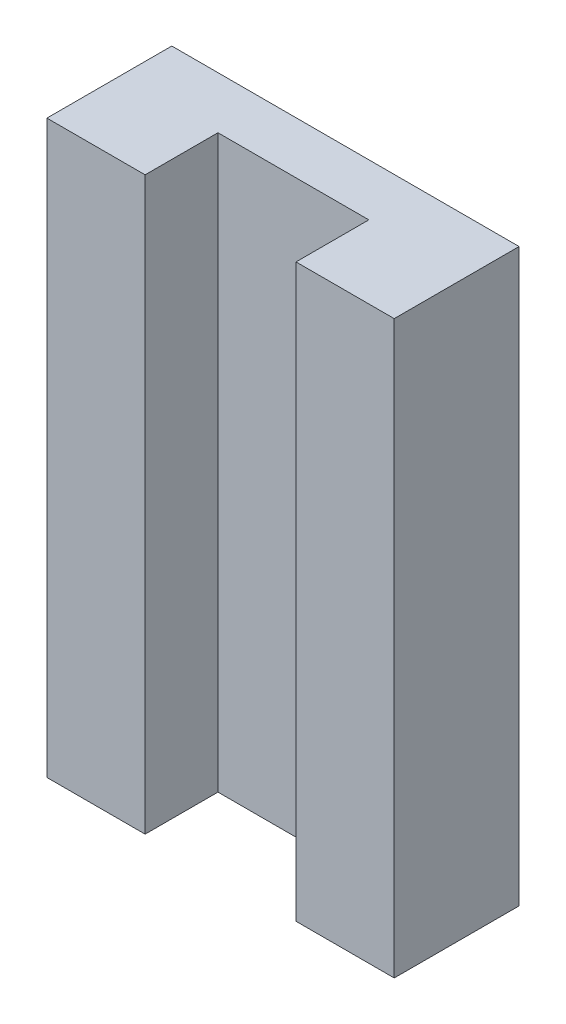
from build123d import *
from build123d.topology import SkipClean

# Parameters (mm, degrees)
SKETCH1_W            = 26.7
SKETCH1_H            = 43.9
BOSS_EXTRUDE1_DEPTH  = 9.6
SKETCH2_W            = 11.6
SKETCH2_H            = 43.9
CUT_EXTRUDE1_DEPTH   = 5.6
SKETCH3_R            = 1.25
CUT_EXTRUDE2_DEPTH   = 4
THREAD1_PITCH        = 0.5
MIRROR2_COPY_1_PITCH = 0.5


with BuildPart() as part:
    # Sketch1 → Boss-Extrude1 (new body)
    with BuildSketch(Plane.XY):
        Rectangle(SKETCH1_W, SKETCH1_H)
    extrude(amount=BOSS_EXTRUDE1_DEPTH)

    # Sketch2 → Cut-Extrude1 (cut)
    with BuildSketch(Plane.XY.offset(9.6)):
        Rectangle(SKETCH2_W, SKETCH2_H)
    extrude(amount=-CUT_EXTRUDE1_DEPTH, mode=Mode.SUBTRACT)

    # Sketch3 → Cut-Extrude2 (cut)
    with BuildSketch(Plane(origin=(0, 0, 0), x_dir=(-1, 0, 0), z_dir=(0, 0, -1))):
        with Locations((10.35, 10.15)):
            Circle(SKETCH3_R)
        with Locations(Location((10.35, -10.15, 0), (0, 0, 180))):
            Circle(SKETCH3_R)
        with Locations((-10.35, -10.15)):
            Circle(SKETCH3_R)
        with Locations(Location((-10.35, 10.15, 0), (0, 0, 180))):
            Circle(SKETCH3_R)
    extrude(amount=-CUT_EXTRUDE2_DEPTH, mode=Mode.SUBTRACT)

    # Thread1: the profile of Thread Profile1 profile screwed along a right-hand helix of 8 turns, 6 arcs to a turn; built about Z, then put on its axis
    with SkipClean():  # the faces are left unmerged after this step: merging them gives an invalid solid
        thread1_z = Axis((0, 0, 0), (0, 0, 1))
        thread1_corners = [(1.2503, 0, -0.000173205), (1.2503, 0, 0.437673204), (0.979367062, 0, 0.281249999), (0.979367062, 0, 0.156249999)]
        with BuildLine(mode=Mode.PRIVATE) as thread1_profile:
            Line(thread1_corners[0], thread1_corners[1])
            Line(thread1_corners[1], thread1_corners[2])
            Line(thread1_corners[2], thread1_corners[3])
            Line(thread1_corners[3], thread1_corners[0])
        thread1_cap = Face(thread1_profile.wire())
        thread1_turn_angles = [0, 30, 60, 90, 120, 150, 180, 210, 240, 270, 300, 330, 360]
        thread1_turn_weights = [1, 0.8660254037844387, 1, 0.8660254037844387, 1, 0.8660254037844387, 1, 0.8660254037844387, 1, 0.8660254037844387, 1, 0.8660254037844387, 1]
        thread1_turn_rails = [Edge.make_bspline([Vector(p[0], p[1], 0).rotate(thread1_z, thread1_turn_angles[k]) / thread1_turn_weights[k] + Vector(0, 0, p[2] + THREAD1_PITCH * thread1_turn_angles[k] / 360) for k in range(13)], [0, 0, 0, 1, 1, 2, 2, 3, 3, 4, 4, 5, 5, 6, 6, 6], 2, thread1_turn_weights) for p in thread1_corners]
        thread1_turn_sides = [Face.make_surface_from_curves(thread1_turn_rails[p[0]], thread1_turn_rails[p[1]]) for p in [(0, 1), (1, 2), (2, 3), (3, 0)]]
        thread1 = Plane(origin=(-10.35, 10.15, 0), x_dir=(1, 0, 0), z_dir=(0, 0, 1)) * Solid(Shell([*[p.moved(Location((0, 0, THREAD1_PITCH * i))) for i in range(8) for p in thread1_turn_sides], thread1_cap, thread1_cap.rotate(thread1_z, 2880).moved(Location((0, 0, THREAD1_PITCH * 2880 / 360)))]))
        add(thread1)

    # Mirror1: Thread1 across plane
    with SkipClean():  # the faces are left unmerged after this step: merging them gives an invalid solid
        add(thread1.mirror(Plane(origin=(0, 0, 0), x_dir=(0, 0, 1), z_dir=(1, 0, 0))))

    # Mirror2: Thread1 across plane
    add(thread1.mirror(Plane.ZX))

    # Mirror2 copy 1: the profile of Mirror2 copy 1 sketch screwed along a right-hand helix of 8 turns, 6 arcs to a turn; built about Z, then put on its axis
    mirror2_copy_1_z = Axis((0, 0, 0), (0, 0, 1))
    mirror2_copy_1_corners = [(1.2503, 0, -0.000173205), (1.2503, 0, 0.437673204), (0.979367062, 0, 0.281249999), (0.979367062, 0, 0.156249999)]
    with BuildLine(mode=Mode.PRIVATE) as mirror2_copy_1_profile:
        Line(mirror2_copy_1_corners[0], mirror2_copy_1_corners[1])
        Line(mirror2_copy_1_corners[1], mirror2_copy_1_corners[2])
        Line(mirror2_copy_1_corners[2], mirror2_copy_1_corners[3])
        Line(mirror2_copy_1_corners[3], mirror2_copy_1_corners[0])
    mirror2_copy_1_cap = Face(mirror2_copy_1_profile.wire())
    mirror2_copy_1_turn_angles = [0, 30, 60, 90, 120, 150, 180, 210, 240, 270, 300, 330, 360]
    mirror2_copy_1_turn_weights = [1, 0.8660254037844387, 1, 0.8660254037844387, 1, 0.8660254037844387, 1, 0.8660254037844387, 1, 0.8660254037844387, 1, 0.8660254037844387, 1]
    mirror2_copy_1_turn_rails = [Edge.make_bspline([Vector(p[0], p[1], 0).rotate(mirror2_copy_1_z, mirror2_copy_1_turn_angles[k]) / mirror2_copy_1_turn_weights[k] + Vector(0, 0, p[2] + MIRROR2_COPY_1_PITCH * mirror2_copy_1_turn_angles[k] / 360) for k in range(13)], [0, 0, 0, 1, 1, 2, 2, 3, 3, 4, 4, 5, 5, 6, 6, 6], 2, mirror2_copy_1_turn_weights) for p in mirror2_copy_1_corners]
    mirror2_copy_1_turn_sides = [Face.make_surface_from_curves(mirror2_copy_1_turn_rails[p[0]], mirror2_copy_1_turn_rails[p[1]]) for p in [(0, 1), (1, 2), (2, 3), (3, 0)]]
    mirror2_copy_1 = Plane(origin=(10.35, -10.15, 0), x_dir=(-1, 0, 0), z_dir=(0, 0, 1)) * Solid(Shell([*[p.moved(Location((0, 0, MIRROR2_COPY_1_PITCH * i))) for i in range(8) for p in mirror2_copy_1_turn_sides], mirror2_copy_1_cap, mirror2_copy_1_cap.rotate(mirror2_copy_1_z, 2880).moved(Location((0, 0, MIRROR2_COPY_1_PITCH * 2880 / 360)))]))
    add(mirror2_copy_1)


solid = part.part
